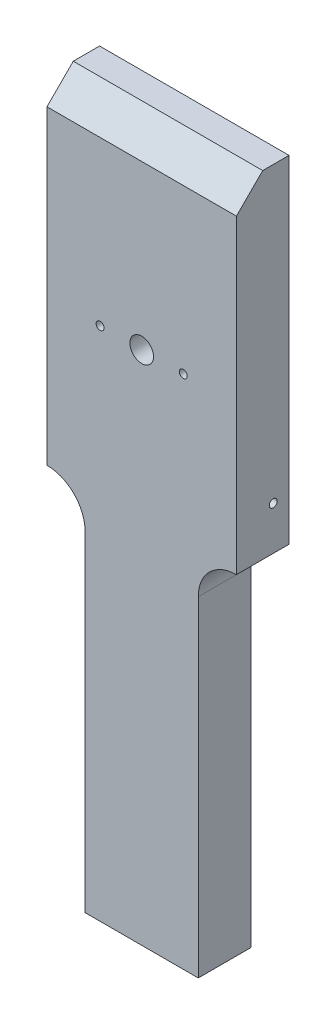
from build123d import *

# Parameters (mm, degrees)
SKETCH1_W           = 228.6
SKETCH1_H           = 406.4
SKETCH1_R           = 14.2875
SKETCH1_R_2         = 4.7625
SKETCH1_W_2         = 136.525
SKETCH1_H_2         = 444.5
BOSS_EXTRUDE1_DEPTH = 63.5
SKETCH2_W           = 38.1
SKETCH2_H           = 495.3
CUT_EXTRUDE1_DEPTH  = 36.5125
SKETCH3_R           = 4.7625
CUT_EXTRUDE2_DEPTH  = 690.786561191
FILLET1_R           = 46.0375
CHAMFER1_SIZE       = 31.75


with BuildPart() as part:
    # Sketch1 → Boss-Extrude1 (new body)
    # profile 1 of 2: a face of its own
    with BuildSketch(Plane.XY):
        Rectangle(SKETCH1_W, SKETCH1_H)
        with Locations((0, -25.4)):
            Circle(SKETCH1_R, mode=Mode.SUBTRACT)
        with Locations((-50.174093823, -25.4)):
            Circle(SKETCH1_R_2, mode=Mode.SUBTRACT)
        with Locations((50.174093823, -25.4)):
            Circle(SKETCH1_R_2, mode=Mode.SUBTRACT)
    # profile 2 of 2: a face of its own
    with BuildSketch(Plane.XY):
        with Locations((0, -425.45)):
            Rectangle(SKETCH1_W_2, SKETCH1_H_2)
    extrude(amount=BOSS_EXTRUDE1_DEPTH)

    # Sketch2 → Cut-Extrude1 (cut)
    with BuildSketch(Plane(origin=(0, 0, 0), x_dir=(-1, 0, 0), z_dir=(0, 0, -1))):
        with Locations((0, -376.2375)):
            Rectangle(SKETCH2_W, SKETCH2_H)
    extrude(amount=-CUT_EXTRUDE1_DEPTH, mode=Mode.SUBTRACT)

    # Sketch3 → Cut-Extrude2 (cut, through all)
    with BuildSketch(Plane.ZY.offset(114.3)):
        with Locations(Location((19.05, -150.8125, 0), (0, 0, 270))):
            Circle(SKETCH3_R)
    extrude(amount=-CUT_EXTRUDE2_DEPTH, mode=Mode.SUBTRACT)

    # Fillet1
    fillet1_edges = [part.edges().sort_by_distance(p)[0] for p in [
        (68.2625, -203.2, 31.75),
        (-68.2625, -203.2, 31.75),
    ]]
    fillet(fillet1_edges, radius=FILLET1_R - 0.0001)  # a hair under: the kernel refuses the full size

    # Chamfer1
    chamfer1_edges = [part.edges().sort_by_distance(p)[0] for p in [
        (0, 203.2, 63.5),
    ]]
    chamfer(chamfer1_edges, length=CHAMFER1_SIZE)


solid = part.part
